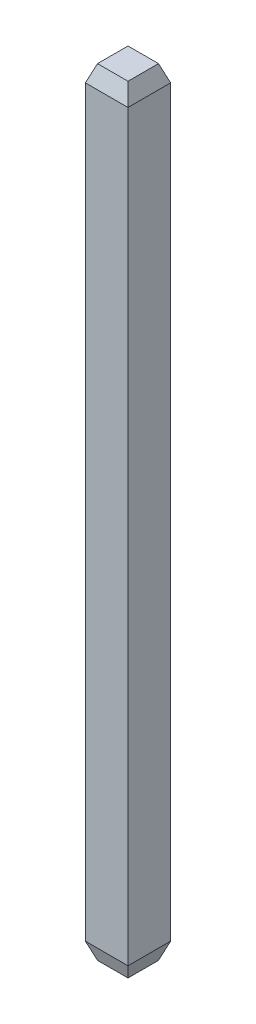
from build123d import *
from OCP.BRepFilletAPI import BRepFilletAPI_MakeChamfer

# Parameters (mm, degrees)
SKETCH_1_W      = 0.64
SKETCH_1_H      = 0.64
EXTRUDE_1_DEPTH = 11.66
CHAMFER_1_SIZE  = 0.25
CHAMFER_1_SIZE2 = 0.090992559
CHAMFER_2_SIZE  = 0.25
CHAMFER_2_SIZE2 = 0.090992559


with BuildPart() as part:
    # Эскиз1 → Бобышка-Вытянуть1 (new body)
    with BuildSketch(Plane(origin=(0, 0, 0), x_dir=(1, 0, 0), z_dir=(0, 1, 0))):
        Rectangle(SKETCH_1_W, SKETCH_1_H)
    extrude(amount=EXTRUDE_1_DEPTH)

    # Фаска1: one chamfer whose edges measure the first distance from different faces: ONE call of the kernel's chamfer builder (chamfer() names one face for all edges)
    chamfer_1_edges_1 = [part.edges().sort_by_distance(p)[0] for p in [
        (0.32, 11.66, 0),
    ]]
    chamfer_1_side_1 = [part.faces().sort_by_distance(p)[0] for p in [
        (0.32, 5.83, 0),
    ]]
    chamfer_1_edges_2 = [part.edges().sort_by_distance(p)[0] for p in [
        (0, 11.66, 0.32),
    ]]
    chamfer_1_side_2 = [part.faces().sort_by_distance(p)[0] for p in [
        (0, 5.83, 0.32),
    ]]
    chamfer_1_edges_3 = [part.edges().sort_by_distance(p)[0] for p in [
        (-0.32, 11.66, 0),
    ]]
    chamfer_1_side_3 = [part.faces().sort_by_distance(p)[0] for p in [
        (-0.32, 5.83, 0),
    ]]
    chamfer_1_edges_4 = [part.edges().sort_by_distance(p)[0] for p in [
        (0, 11.66, -0.32),
    ]]
    chamfer_1_side_4 = [part.faces().sort_by_distance(p)[0] for p in [
        (0, 5.83, -0.32),
    ]]
    chamfer_1 = BRepFilletAPI_MakeChamfer(part.part.solid().wrapped)
    for e in chamfer_1_edges_1:
        chamfer_1.Add(CHAMFER_1_SIZE, CHAMFER_1_SIZE2, e.wrapped, chamfer_1_side_1[0].wrapped)  # the first distance lies on this face
    for e in chamfer_1_edges_2:
        chamfer_1.Add(CHAMFER_1_SIZE, CHAMFER_1_SIZE2, e.wrapped, chamfer_1_side_2[0].wrapped)  # the first distance lies on this face
    for e in chamfer_1_edges_3:
        chamfer_1.Add(CHAMFER_1_SIZE, CHAMFER_1_SIZE2, e.wrapped, chamfer_1_side_3[0].wrapped)  # the first distance lies on this face
    for e in chamfer_1_edges_4:
        chamfer_1.Add(CHAMFER_1_SIZE, CHAMFER_1_SIZE2, e.wrapped, chamfer_1_side_4[0].wrapped)  # the first distance lies on this face
    add(Compound.cast(chamfer_1.Shape()), mode=Mode.REPLACE)

    # Фаска2: one chamfer whose edges measure the first distance from different faces: ONE call of the kernel's chamfer builder (chamfer() names one face for all edges)
    chamfer_2_edges_1 = [part.edges().sort_by_distance(p)[0] for p in [
        (0, 0, -0.32),
    ]]
    chamfer_2_side_1 = [part.faces().sort_by_distance(p)[0] for p in [
        (0, 5.705, -0.32),
    ]]
    chamfer_2_edges_2 = [part.edges().sort_by_distance(p)[0] for p in [
        (-0.32, 0, 0),
    ]]
    chamfer_2_side_2 = [part.faces().sort_by_distance(p)[0] for p in [
        (-0.32, 5.705, 0),
    ]]
    chamfer_2_edges_3 = [part.edges().sort_by_distance(p)[0] for p in [
        (0, 0, 0.32),
    ]]
    chamfer_2_side_3 = [part.faces().sort_by_distance(p)[0] for p in [
        (0, 5.705, 0.32),
    ]]
    chamfer_2_edges_4 = [part.edges().sort_by_distance(p)[0] for p in [
        (0.32, 0, 0),
    ]]
    chamfer_2_side_4 = [part.faces().sort_by_distance(p)[0] for p in [
        (0.32, 5.705, 0),
    ]]
    chamfer_2 = BRepFilletAPI_MakeChamfer(part.part.solid().wrapped)
    for e in chamfer_2_edges_1:
        chamfer_2.Add(CHAMFER_2_SIZE, CHAMFER_2_SIZE2, e.wrapped, chamfer_2_side_1[0].wrapped)  # the first distance lies on this face
    for e in chamfer_2_edges_2:
        chamfer_2.Add(CHAMFER_2_SIZE, CHAMFER_2_SIZE2, e.wrapped, chamfer_2_side_2[0].wrapped)  # the first distance lies on this face
    for e in chamfer_2_edges_3:
        chamfer_2.Add(CHAMFER_2_SIZE, CHAMFER_2_SIZE2, e.wrapped, chamfer_2_side_3[0].wrapped)  # the first distance lies on this face
    for e in chamfer_2_edges_4:
        chamfer_2.Add(CHAMFER_2_SIZE, CHAMFER_2_SIZE2, e.wrapped, chamfer_2_side_4[0].wrapped)  # the first distance lies on this face
    add(Compound.cast(chamfer_2.Shape()), mode=Mode.REPLACE)


solid = part.part
